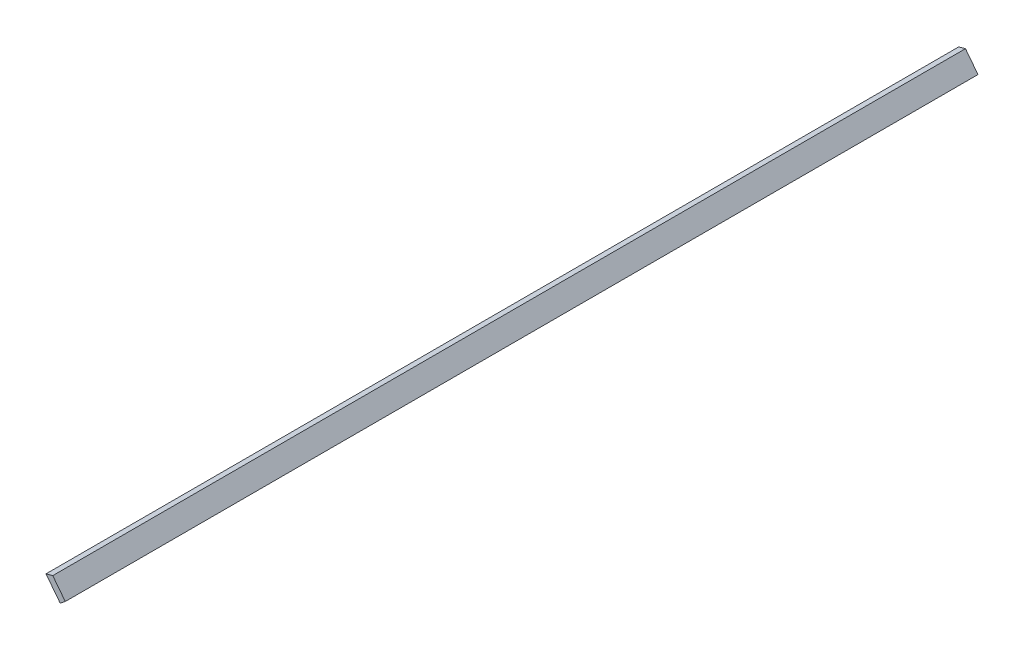
from build123d import *

# Parameters (mm, degrees)
BOSS_EXTRUDE1_DEPTH = 895.35


with BuildPart() as part:
    # Sketch1 → Boss-Extrude1 (new body)
    with BuildSketch(Plane.XY):
        Polygon((0, 0), (5.024531297, 3.88285787), (-7.245299573, 19.76037677), (-13.878163261, 17.958747908), align=None)
    extrude(amount=BOSS_EXTRUDE1_DEPTH)


solid = part.part
